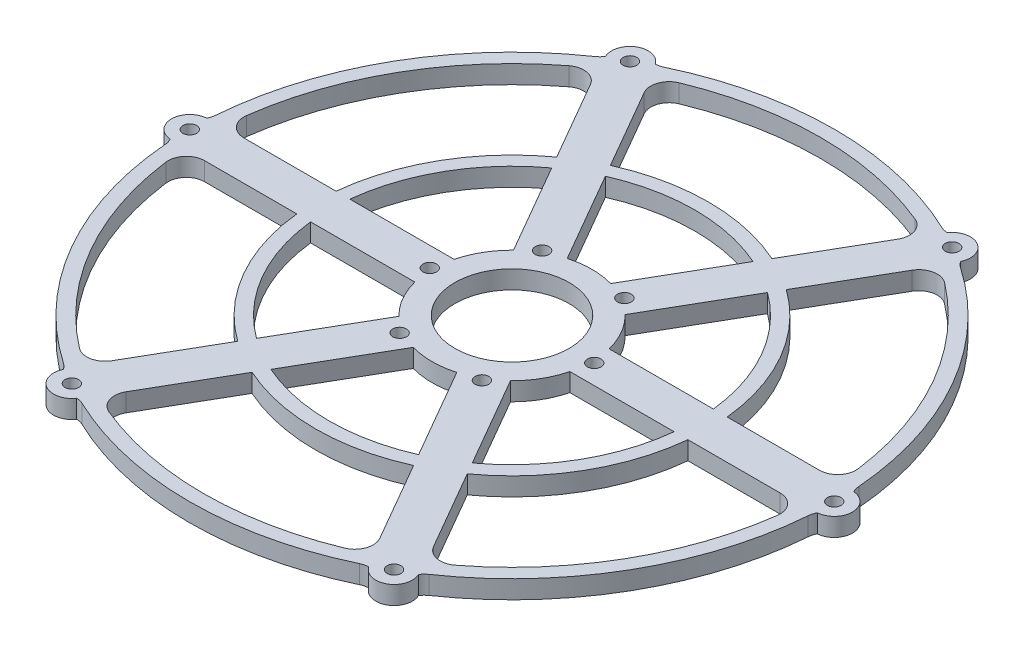
from build123d import *
from build123d.topology import SkipClean

# Parameters (mm, degrees)
SKETCH_1_R           = 1.4999999999999996
SKETCH_1_R_2         = 1.4999999999999998
SKETCH_1_R_3         = 1.5
SKETCH_1_R_4         = 1.4999999999999993
SKETCH_1_R_5         = 1.4999999999999971
SKETCH_1_R_6         = 1.5000000000000007
SKETCH_1_R_7         = 1.4999999999999944
SKETCH_1_R_8         = 1.4999999999999918
SKETCH_1_R_9         = 1.4999999999999887
SKETCH_1_R_10        = 4.5
EXTRUDE_1_DEPTH      = 4
FILLET_1_R           = 4
FILLET_2_R           = 4
EXTRUDE_2_DEPTH      = 5
EXTRUDE_2_DEPTH_BACK = 9
CHAMFER_1_SIZE       = 0.5
SKETCH_3_R           = 43
SKETCH_3_R_2         = 40
EXTRUDE_3_DEPTH      = 4
SKETCH_4_R           = 12.5
CUT_EXTRUDE_1_DEPTH  = 10
SKETCH_5_R           = 17.500000000000004
SKETCH_5_R_2         = 12.5
EXTRUDE_4_DEPTH      = 4
SKETCH_6_R           = 1.4999999999999987
SKETCH_6_R_2         = 1.4999999999997233
SKETCH_6_R_3         = 1.500000000000449
SKETCH_6_R_4         = 1.500000000001465
SKETCH_6_R_5         = 1.5000000000018021
SKETCH_6_R_6         = 1.5000000000011438
CUT_EXTRUDE_2_DEPTH  = 9.000000000000002
SKETCH_7_R           = 99.6246168555559
CUT_EXTRUDE_3_DEPTH  = 33
SKETCH_8_R           = 104.70068375535166
CUT_EXTRUDE_4_DEPTH  = 205.00000000000003
SKETCH_9_R           = 4.000000000000007
SKETCH_9_R_2         = 1.4999999999999973
SKETCH_9_R_3         = 3.999999999998955
SKETCH_9_R_4         = 1.4999999999989577
SKETCH_9_R_5         = 4.000000000001806
SKETCH_9_R_6         = 1.500000000001791
SKETCH_9_R_7         = 4.0000000000058265
SKETCH_9_R_8         = 1.500000000005815
SKETCH_9_R_9         = 4.000000000007099
SKETCH_9_R_10        = 1.5000000000070977
SKETCH_9_R_11        = 4.000000000004524
SKETCH_9_R_12        = 1.5000000000045177
EXTRUDE_5_DEPTH      = 4


with BuildPart() as part:
    # 草图1 → 凸台-拉伸1 (new body)
    with BuildSketch(Plane(origin=(0, 0, 0), x_dir=(1, 0, 0), z_dir=(0, 1, 0))):
        with BuildLine():
            ThreePointArc((-70.5, 3.000000000000008), (-73.50000000000001, 3.7e-16), (-70.5, -3.000000000000008))
            ThreePointArc((-70.5, -3.000000000000008), (-61.11004418260574, -35.281900459016875), (-37.84807621135403, -59.55479096680248))
            ThreePointArc((-37.84807621135403, -59.55479096680248), (-36.75000000000076, -63.65286717815582), (-32.65192378864741, -62.55479096680256))
            ThreePointArc((-32.65192378864741, -62.55479096680256), (-7.3209e-13, -70.56380091803446), (32.65192378864611, -62.55479096680326))
            ThreePointArc((32.65192378864611, -62.55479096680326), (36.74999999999942, -63.65286717815661), (37.848076211352776, -59.5547909668033))
            ThreePointArc((37.848076211352776, -59.5547909668033), (61.110044182605264, -35.281900459017756), (70.49999999999999, -3.0000000000005))
            ThreePointArc((70.49999999999999, -3.0000000000005), (73.50000000000001, -5.1362e-13), (70.50000000000003, 2.9999999999995155))
            ThreePointArc((70.50000000000003, 2.9999999999995155), (61.11004418260573, 35.28190045901688), (37.84807621135361, 59.55479096680278))
            ThreePointArc((37.84807621135361, 59.55479096680278), (36.75000000000032, 63.65286717815611), (32.65192378864698, 62.55479096680282))
            ThreePointArc((32.65192378864698, 62.55479096680282), (2.3935e-13, 70.5638009180345), (-32.65192378864655, 62.55479096680301))
            ThreePointArc((-32.65192378864655, 62.55479096680301), (-36.74999999999988, 63.65286717815634), (-37.84807621135321, 59.55479096680301))
            ThreePointArc((-37.84807621135321, 59.55479096680301), (-61.110044182605506, 35.281900459017315), (-70.5, 3.000000000000008))
        make_face()
        with Locations(Location((-8, 0, 0), (0, 0, 270))):
            Circle(SKETCH_1_R, mode=Mode.SUBTRACT)
        with Locations(Location((2.793e-14, 8, 0), (0, 0, 270))):
            Circle(SKETCH_1_R_2, mode=Mode.SUBTRACT)
        with Locations(Location((8, -5.586e-14, 0), (0, 0, 270))):
            Circle(SKETCH_1_R_3, mode=Mode.SUBTRACT)
        with Locations(Location((-8.38e-14, -7.999999999999998, 0), (0, 0, 270))):
            Circle(SKETCH_1_R_4, mode=Mode.SUBTRACT)
        with Locations(Location((-70.5, 0, 0), (0, 0, 270))):
            Circle(SKETCH_1_R_5, mode=Mode.SUBTRACT)
        with Locations(Location((-35.24999999999988, 61.05479096680301, 0), (0, 0, 270))):
            Circle(SKETCH_1_R_5, mode=Mode.SUBTRACT)
        with Locations(Location((35.2500000000003, 61.0547909668028, 0), (0, 0, 270))):
            Circle(SKETCH_1_R_6, mode=Mode.SUBTRACT)
        with Locations(Location((70.5, -4.923e-13, 0), (0, 0, 270))):
            Circle(SKETCH_1_R_7, mode=Mode.SUBTRACT)
        with Locations(Location((35.24999999999944, -61.05479096680328, 0), (0, 0, 270))):
            Circle(SKETCH_1_R_8, mode=Mode.SUBTRACT)
        with Locations(Location((-35.25000000000072, -61.054790966802514, 0), (0, 0, 270))):
            Circle(SKETCH_1_R_9, mode=Mode.SUBTRACT)
        with Locations(Location((0, 0, 0), (0, 0, 270))):
            Circle(SKETCH_1_R_10, mode=Mode.SUBTRACT)
        with BuildLine():
            Line((-9.579036496304667, 4.3002395052442415), (-67.36288251105003, 4.300239505244943))
            ThreePointArc((-67.36288251105003, 4.300239505244943), (-58.45671475544931, 33.75000000000055), (-37.405557909423486, 56.187847774094074))
            Line((-37.405557909423486, 56.187847774094074), (-8.513634902051102, 6.145569196956236))
            ThreePointArc((-8.513634902051102, 6.145569196956236), (-9.093266739736535, 5.250000000000124), (-9.579036496304667, 4.3002395052442415))
        make_face(mode=Mode.SUBTRACT)
        with BuildLine():
            Line((-9.579036496304774, -4.300239505243998), (-67.36288251105012, -4.300239505243795))
            ThreePointArc((-67.36288251105012, -4.300239505243795), (-58.45671475544982, -33.749999999999666), (-37.405557909424274, -56.18784777409356))
            Line((-37.405557909424274, -56.18784777409356), (-8.513634902051185, -6.145569196956118))
            ThreePointArc((-8.513634902051185, -6.145569196956118), (-9.093266739736634, -5.249999999999946), (-9.579036496304774, -4.300239505243998))
        make_face(mode=Mode.SUBTRACT)
        with BuildLine():
            Line((67.36288251105009, -4.300239505244269), (9.579036496304743, -4.3002395052440665))
            ThreePointArc((9.579036496304743, -4.3002395052440665), (9.093266739736448, -5.250000000000277), (8.513634902050788, -6.145569196956676))
            Line((8.513634902050788, -6.145569196956676), (37.405557909423074, -56.18784777409434))
            ThreePointArc((37.405557909423074, -56.18784777409434), (58.45671475544934, -33.7500000000005), (67.36288251105009, -4.300239505244269))
        make_face(mode=Mode.SUBTRACT)
        with BuildLine():
            Line((67.36288251105015, 4.300239505243303), (9.579036496304996, 4.300239505243507))
            ThreePointArc((9.579036496304996, 4.300239505243507), (9.093266739736636, 5.249999999999946), (8.513634902050875, 6.145569196956556))
            Line((8.513634902050875, 6.145569196956556), (37.40555790942386, 56.187847774093825))
            ThreePointArc((37.40555790942386, 56.187847774093825), (58.45671475544981, 33.74999999999966), (67.36288251105015, 4.300239505243303))
        make_face(mode=Mode.SUBTRACT)
        with BuildLine():
            Line((-1.065401594254097, 10.44580870220017), (-29.957324601626386, 60.48808727933784))
            ThreePointArc((-29.957324601626386, 60.48808727933784), (2.1397e-13, 67.50000000000003), (29.957324601626794, 60.48808727933765))
            Line((29.957324601626794, 60.48808727933765), (1.065401594253708, 10.445808702200214))
            ThreePointArc((1.065401594253708, 10.445808702200214), (-1.952e-13, 10.500000000000004), (-1.065401594254097, 10.44580870220017))
        make_face(mode=Mode.SUBTRACT)
        with BuildLine():
            Line((29.957324601625945, -60.48808727933805), (1.0654015942535602, -10.445808702200226))
            ThreePointArc((1.0654015942535602, -10.445808702200226), (-3.4441e-13, -10.500000000000004), (-1.0654015942542432, -10.44580870220016))
            Line((-1.0654015942542432, -10.44580870220016), (-29.957324601627235, -60.48808727933743))
            ThreePointArc((-29.957324601627235, -60.48808727933743), (-7.1529e-13, -67.50000000000001), (29.957324601625945, -60.48808727933805))
        make_face(mode=Mode.SUBTRACT)
    extrude(amount=EXTRUDE_1_DEPTH)

    # 圆角1
    fillet_1_edges = [part.edges().sort_by_distance(p)[0] for p in [
        (-32.651923788646556, 2, -62.554790966803),
        (32.65192378864698, 2, -62.55479096680281),
        (37.848076211353614, 2, -59.55479096680278),
        (70.50000000000003, 2, -2.9999999999995124),
        (70.49999999999997, 2, 3.000000000000502),
        (37.848076211352776, 2, 59.554790966803296),
        (32.651923788646116, 2, 62.55479096680326),
        (-32.65192378864741, 2, 62.55479096680256),
        (-37.84807621135403, 2, 59.55479096680247),
        (-70.5, 2, 3.0000000000000093),
        (-70.50000000000001, 2, -3.000000000000006),
        (-37.84807621135322, 2, -59.55479096680301),
        (29.957324601625942, 2, 60.488087279338046),
        (-29.957324601627235, 2, 60.488087279337435),
        (67.36288251105009, 2, 4.30023950524427),
        (37.40555790942307, 2, 56.18784777409434),
        (37.40555790942386, 2, -56.187847774093825),
        (67.36288251105015, 2, -4.300239505243307),
        (-29.957324601626386, 2, -60.48808727933785),
        (29.957324601626794, 2, -60.488087279337655),
        (-67.36288251105003, 2, -4.300239505244943),
        (-37.40555790942349, 2, -56.18784777409407),
        (-67.36288251105012, 2, 4.300239505243796),
        (-37.405557909424274, 2, 56.18784777409357),
    ]]
    fillet(fillet_1_edges, radius=FILLET_1_R)

    # 圆角2
    # the kernel refuses this fillet: 4 mm, written as the material it adds along each edge
    with BuildSketch(Plane(origin=(-1.0654015942542432, 0, 10.44580870220016), x_dir=(-0.5000000000000071, 0, 0.8660254037844346), z_dir=(0, 1, 0))) as fillet_2_piece_1:
        with BuildLine():
            CenterArc((2.3102874607430097, 4.000000000000001), FILLET_2_R, 214.9198731811867, 55.08012681881331)
            ThreePointArc((-0.9695260446492189, 1.710278757174414), (-0.44464689566161064, 0.8778804840632212), (0, 0))
            Line((0, 0), (2.31028746074301, 1e-17))
        make_face()
    extrude(amount=4)
    with BuildSketch(Plane(origin=(-8.513634902051187, 0, 6.145569196956119), x_dir=(-0.5068146140540679, 0, -0.8620550718957729), z_dir=(0, 1, 0))) as fillet_2_piece_2:
        with BuildLine():
            CenterArc((2.3404393067669487, 3.9824329250590425), FILLET_2_R, 209.5481152574792, 55.08012681882752)
            Line((-1.1393281601452958, 2.0098157862763673), (0, 0))
            ThreePointArc((0, 0), (0.9829845088421205, 0.04611357172001613), (1.9659690176842453, -4e-17))
        make_face()
    extrude(amount=4)
    with BuildSketch(Plane(origin=(-9.579036496304774, 0, 4.300239505243998), x_dir=(-1, 0, -3.46e-15), z_dir=(0, 1, 0))) as fillet_2_piece_3:
        with BuildLine():
            CenterArc((2.310287460742878, 4), FILLET_2_R, 214.91987318118893, 55.08012681881104)
            ThreePointArc((-0.9695260446492592, 1.7102787571742841), (-0.44464689566163024, 0.877880484063158), (0, 0))
            Line((0, 0), (2.3102874607428774, 0))
        make_face()
    extrude(amount=4)
    with BuildSketch(Plane(origin=(-9.579036496304667, 0, -4.300239505244241), x_dir=(0.49315428469593503, 0, -0.86994186672791), z_dir=(0, 1, 0))) as fillet_2_piece_4:
        with BuildLine():
            CenterArc((2.340439306766931, 3.982432925059041), FILLET_2_R, 209.54811525747962, 55.08012681882701)
            Line((-1.1393281601452994, 2.0098157862763424), (0, 0))
            ThreePointArc((0, 0), (0.9829845088421114, 0.04611357172001763), (1.9659690176842226, 1e-16))
        make_face()
    extrude(amount=4)
    with BuildSketch(Plane(origin=(-8.513634902051102, 0, -6.145569196956236), x_dir=(-0.4999999999999958, 0, -0.866025403784441), z_dir=(0, 1, 0))) as fillet_2_piece_5:
        with BuildLine():
            CenterArc((2.310287460742879, 3.9999999999999996), FILLET_2_R, 214.91987318118888, 55.080126818811095)
            ThreePointArc((-0.9695260446492604, 1.7102787571742883), (-0.4446468956616306, 0.8778804840631608), (0, 0))
            Line((0, 0), (2.3102874607428756, 0))
        make_face()
    extrude(amount=4)
    with BuildSketch(Plane(origin=(1.0654015942537083, 0, -10.445808702200214), x_dir=(0.5000000000000073, 0, -0.8660254037844344), z_dir=(0, 1, 0))) as fillet_2_piece_6:
        with BuildLine():
            CenterArc((2.3102874607428614, 4), FILLET_2_R, 214.91987318118936, 55.08012681881064)
            ThreePointArc((-0.9695260446492604, 1.710278757174261), (-0.4446468956616301, 0.8778804840631479), (0, 0))
            Line((0, 0), (2.3102874607428623, 1e-17))
        make_face()
    extrude(amount=4)
    with BuildSketch(Plane(origin=(-1.065401594254097, 0, -10.445808702200168), x_dir=(0.9999688987499935, 0, -0.007886794832196306), z_dir=(0, 1, 0))) as fillet_2_piece_7:
        with BuildLine():
            CenterArc((2.34043930676708, 3.9824329250590376), FILLET_2_R, 209.5481152574761, 55.08012681882997)
            Line((-1.13932816014527, 2.0098157862765516), (0, 0))
            ThreePointArc((0, 0), (0.9829845088421648, 0.04611357172002539), (1.96596901768433, 0))
        make_face()
    extrude(amount=4)
    with BuildSketch(Plane(origin=(9.579036496304996, 0, -4.300239505243507), x_dir=(1, 0, 3.08e-15), z_dir=(0, 1, 0))) as fillet_2_piece_8:
        with BuildLine():
            CenterArc((2.3102874607430053, 4), FILLET_2_R, 214.9198731811863, 55.08012681881371)
            ThreePointArc((-0.9695260446492372, 1.7102787571744347), (-0.44464689566161925, 0.8778804840632319), (0, 0))
            Line((0, 0), (2.3102874607430035, 0))
        make_face()
    extrude(amount=4)
    with BuildSketch(Plane(origin=(8.513634902050875, 0, -6.145569196956556), x_dir=(0.5068146140541091, 0, 0.8620550718957487), z_dir=(0, 1, 0))) as fillet_2_piece_9:
        with BuildLine():
            CenterArc((2.340439306767016, 3.982432925059042), FILLET_2_R, 209.54811525747644, 55.08012681883031)
            Line((-1.1393281601453242, 2.009815786276536), (0, 0))
            ThreePointArc((0, 0), (0.9829845088421585, 0.04611357172001612), (1.965969017684317, 1e-17))
        make_face()
    extrude(amount=4)
    with BuildSketch(Plane(origin=(9.579036496304745, 0, 4.3002395052440665), x_dir=(-0.49315428469592015, 0, 0.8699418667279183), z_dir=(0, 1, 0))) as fillet_2_piece_10:
        with BuildLine():
            CenterArc((2.3404393067669487, 3.9824329250590416), FILLET_2_R, 209.54811525747917, 55.08012681882752)
            Line((-1.1393281601452967, 2.0098157862763704), (0, 0))
            ThreePointArc((0, 0), (0.9829845088421224, 0.04611357172001689), (1.9659690176842455, -5e-17))
        make_face()
    extrude(amount=4)
    with BuildSketch(Plane(origin=(8.51363490205079, 0, 6.145569196956677), x_dir=(0.4999999999999941, 0, 0.866025403784442), z_dir=(0, 1, 0))) as fillet_2_piece_11:
        with BuildLine():
            CenterArc((2.310287460742971, 4), FILLET_2_R, 214.9198731811868, 55.080126818813255)
            ThreePointArc((-0.969526044649251, 1.7102787571744063), (-0.44464689566161575, 0.8778804840632242), (0, 0))
            Line((0, 0), (2.3102874607429755, 0))
        make_face()
    extrude(amount=4)
    with BuildSketch(Plane(origin=(1.0654015942535602, 0, 10.445808702200228), x_dir=(0.4999999999999959, 0, 0.8660254037844409), z_dir=(0, 1, 0))) as fillet_2_piece_12:
        with BuildLine():
            CenterArc((2.3102874607428734, -4), FILLET_2_R, 89.99999999999994, 55.08012681881101)
            ThreePointArc((-0.9695260446492603, -1.7102787571742772), (-0.4446468956616315, -0.8778804840631549), (0, 0))
            Line((0, 0), (2.3102874607428774, -2.2e-16))
        make_face()
    extrude(amount=4)

    # 草图2 → 凸台-拉伸2 (add, two sides: drawn at the far end of the back side and taken through both)
    with SkipClean():  # the faces are left unmerged after this step: merging them gives an invalid solid
        with BuildSketch(Plane(origin=(0, 0, 0), x_dir=(-1, 0, 0), z_dir=(0, -1, 0)).offset(-EXTRUDE_2_DEPTH_BACK)):
            with BuildLine():
                Line((23.0863596744827, -63.429251903048794), (23.5993898894712, -64.83879083422764))
                ThreePointArc((23.5993898894712, -64.83879083422764), (4.23e-15, -68.99999999999999), (-23.5993898894712, -64.83879083422764))
                Line((-23.5993898894712, -64.83879083422764), (-23.0863596744827, -63.429251903048794))
                ThreePointArc((-23.0863596744827, -63.429251903048794), (4.13e-15, -67.5), (23.0863596744827, -63.429251903048794))
            make_face()
            with BuildLine():
                Line((-43.38816365384148, -51.70799991053096), (-44.352345068371285, -52.85706657520941))
                ThreePointArc((-44.352345068371285, -52.85706657520941), (-59.75575286112633, -34.49999999999986), (-67.95173495784238, -11.981724259017966))
                Line((-67.95173495784238, -11.981724259017966), (-66.4745233283241, -11.721251992517583))
                ThreePointArc((-66.4745233283241, -11.721251992517583), (-58.4567147554497, -33.74999999999988), (-43.38816365384148, -51.70799991053096))
            make_face()
            with BuildLine():
                Line((-66.47452332832401, 11.721251992518056), (-67.9517349578423, 11.981724259018446))
                ThreePointArc((-67.9517349578423, 11.981724259018446), (-59.755752861126105, 34.50000000000029), (-44.352345068370916, 52.857066575209736))
                Line((-44.352345068370916, 52.857066575209736), (-43.388163653841126, 51.70799991053128))
                ThreePointArc((-43.388163653841126, 51.70799991053128), (-58.45671475544946, 33.75000000000029), (-66.47452332832401, 11.721251992518056))
            make_face()
            with BuildLine():
                Line((-23.086359674482257, 63.429251903048964), (-23.599389889470746, 64.83879083422781))
                ThreePointArc((-23.599389889470746, 64.83879083422781), (4.945e-13, 68.99999999999997), (23.599389889471656, 64.83879083422747))
                Line((23.599389889471656, 64.83879083422747), (23.086359674483145, 63.42925190304863))
                ThreePointArc((23.086359674483145, 63.42925190304863), (4.6876e-13, 67.5), (-23.086359674482257, 63.429251903048964))
            make_face()
            with BuildLine():
                Line((43.388163653841836, 51.70799991053065), (44.35234506837164, 52.8570665752091))
                ThreePointArc((44.35234506837164, 52.8570665752091), (59.755752861126574, 34.49999999999944), (67.95173495784246, 11.981724259017493))
                Line((67.95173495784246, 11.981724259017493), (66.47452332832417, 11.721251992517116))
                ThreePointArc((66.47452332832417, 11.721251992517116), (58.45671475544992, 33.74999999999946), (43.388163653841836, 51.70799991053065))
            make_face()
            with BuildLine():
                Line((66.47452332832391, -11.721251992518493), (67.9517349578422, -11.981724259018899))
                ThreePointArc((67.9517349578422, -11.981724259018899), (59.75575286112585, -34.500000000000675), (44.35234506837053, -52.85706657521001))
                Line((44.35234506837053, -52.85706657521001), (43.388163653840756, -51.70799991053155))
                ThreePointArc((43.388163653840756, -51.70799991053155), (58.45671475544921, -33.75000000000066), (66.47452332832391, -11.721251992518493))
            make_face()
        extrude(amount=EXTRUDE_2_DEPTH + EXTRUDE_2_DEPTH_BACK)

    # 倒角1
    chamfer_1_edges = [part.edges().sort_by_distance(p)[0] for p in [
        (7.11e-15, -5, 68.99999999999997),
        (59.75575286112634, -5, 34.49999999999986),
        (59.755752861126126, -5, -34.5000000000003),
        (-4.8939e-13, -5, -68.99999999999997),
        (-59.75575286112658, -5, -34.49999999999944),
        (-59.755752861125856, -5, 34.50000000000067),
    ]]
    chamfer(chamfer_1_edges, length=CHAMFER_1_SIZE)

    # 草图3 → 凸台-拉伸3 (add)
    with SkipClean():  # the faces are left unmerged after this step: merging them gives an invalid solid
        with BuildSketch(Plane(origin=(0, 4, 0), x_dir=(1, 0, 0), z_dir=(0, 1, 0))):
            Circle(SKETCH_3_R)
            Circle(SKETCH_3_R_2, mode=Mode.SUBTRACT)
        extrude(amount=-EXTRUDE_3_DEPTH)

    # 草图4 → 切除-拉伸1 (cut)
    with SkipClean():  # the faces are left unmerged after this step: merging them gives an invalid solid
        with BuildSketch(Plane(origin=(0, 4, 0), x_dir=(1, 0, 0), z_dir=(0, 1, 0))):
            Circle(SKETCH_4_R)
        extrude(amount=-CUT_EXTRUDE_1_DEPTH, mode=Mode.SUBTRACT)

    # 草图5 → 凸台-拉伸4 (add)
    with SkipClean():  # the faces are left unmerged after this step: merging them gives an invalid solid
        with BuildSketch(Plane(origin=(0, 4, 0), x_dir=(1, 0, 0), z_dir=(0, 1, 0))):
            Circle(SKETCH_5_R)
            with Locations(Location((0, 0, 0), (0, 0, 270))):
                Circle(SKETCH_5_R_2, mode=Mode.SUBTRACT)
        extrude(amount=-EXTRUDE_4_DEPTH)

    # 草图6 → 切除-拉伸2 (cut)
    with SkipClean():  # the faces are left unmerged after this step: merging them gives an invalid solid
        with BuildSketch(Plane.XZ):
            with Locations(Location((8.999999999999854, 15.58845726811998, 0), (0, 0, 270))):
                Circle(SKETCH_6_R)
            with Locations(Location((18.000000000000888, 6.7967e-13, 0), (0, 0, 270))):
                Circle(SKETCH_6_R_2)
            with Locations(Location((9.000000000001913, -15.588457268119818, 0), (0, 0, 270))):
                Circle(SKETCH_6_R_3)
            with Locations(Location((-8.999999999998092, -15.588457268121008, 0), (0, 0, 270))):
                Circle(SKETCH_6_R_4)
            with Locations(Location((-17.999999999999126, -1.70974e-12, 0), (0, 0, 270))):
                Circle(SKETCH_6_R_5)
            with Locations(Location((-9.000000000000162, 15.588457268118784, 0), (0, 0, 270))):
                Circle(SKETCH_6_R_6)
        extrude(amount=-CUT_EXTRUDE_2_DEPTH, mode=Mode.SUBTRACT)

    # 草图7 → 切除-拉伸3 (cut)
    with BuildSketch(Plane(origin=(0, 0, 0), x_dir=(-1, 0, 0), z_dir=(0, -1, 0))):
        Circle(SKETCH_7_R)
    extrude(amount=CUT_EXTRUDE_3_DEPTH, mode=Mode.SUBTRACT)

    # 草图8 → 切除-拉伸4 (cut)
    with BuildSketch(Plane(origin=(0, 4, 0), x_dir=(1, 0, 0), z_dir=(0, 1, 0))):
        Circle(SKETCH_8_R)
    extrude(amount=CUT_EXTRUDE_4_DEPTH, mode=Mode.SUBTRACT)

    # 草图9 → 凸台-拉伸5 (add)
    # profile 1 of 6: a face of its own
    with BuildSketch(Plane(origin=(0, 0, 0), x_dir=(-1, 0, 0), z_dir=(0, -1, 0))):
        with Locations((35.24999999999988, 61.05479096680301)):
            Circle(SKETCH_9_R)
        with Locations(Location((35.24999999999988, 61.05479096680301, 0), (0, 0, 270))):
            Circle(SKETCH_9_R_2, mode=Mode.SUBTRACT)
    # profile 2 of 6: a face of its own
    with BuildSketch(Plane(origin=(0, 0, 0), x_dir=(-1, 0, 0), z_dir=(0, -1, 0))):
        with Locations((70.5000000000035, 2.17193e-12)):
            Circle(SKETCH_9_R_3)
        with Locations(Location((70.5000000000035, 2.17193e-12, 0), (0, 0, 270))):
            Circle(SKETCH_9_R_4, mode=Mode.SUBTRACT)
    # profile 3 of 6: a face of its own
    with BuildSketch(Plane(origin=(0, 0, 0), x_dir=(-1, 0, 0), z_dir=(0, -1, 0))):
        with Locations((35.2500000000071, -61.05479096680287)):
            Circle(SKETCH_9_R_5)
        with Locations(Location((35.2500000000071, -61.05479096680287, 0), (0, 0, 270))):
            Circle(SKETCH_9_R_6, mode=Mode.SUBTRACT)
    # profile 4 of 6: a face of its own
    with BuildSketch(Plane(origin=(0, 0, 0), x_dir=(-1, 0, 0), z_dir=(0, -1, 0))):
        with Locations((-35.24999999999293, -61.05479096680704)):
            Circle(SKETCH_9_R_7)
        with Locations(Location((-35.24999999999293, -61.05479096680704, 0), (0, 0, 270))):
            Circle(SKETCH_9_R_8, mode=Mode.SUBTRACT)
    # profile 5 of 6: a face of its own
    with BuildSketch(Plane(origin=(0, 0, 0), x_dir=(-1, 0, 0), z_dir=(0, -1, 0))):
        with Locations((-70.49999999999656, -6.20346e-12)):
            Circle(SKETCH_9_R_9)
        with Locations(Location((-70.49999999999656, -6.20346e-12, 0), (0, 0, 270))):
            Circle(SKETCH_9_R_10, mode=Mode.SUBTRACT)
    # profile 6 of 6: a face of its own
    with BuildSketch(Plane(origin=(0, 0, 0), x_dir=(-1, 0, 0), z_dir=(0, -1, 0))):
        with Locations((-35.25000000000019, 61.05479096679882)):
            Circle(SKETCH_9_R_11)
        with Locations(Location((-35.25000000000019, 61.05479096679882, 0), (0, 0, 270))):
            Circle(SKETCH_9_R_12, mode=Mode.SUBTRACT)
    extrude(amount=-EXTRUDE_5_DEPTH)


solid = part.part
